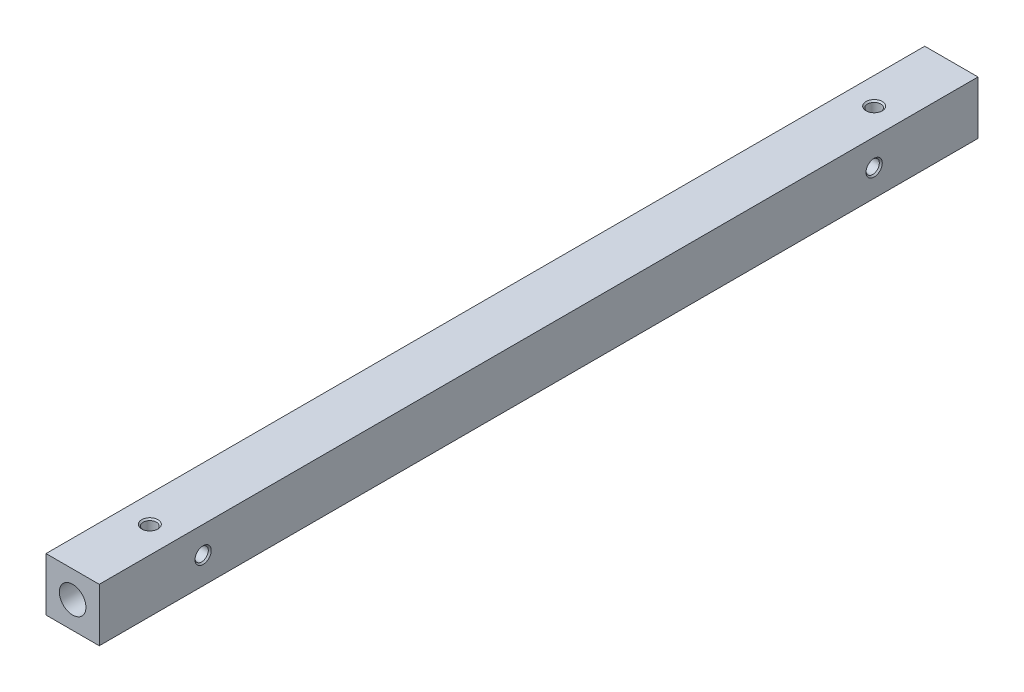
from build123d import *

# Parameters (mm, degrees)
ESQUISSE1_W                     = 10
ESQUISSE1_H                     = 10
BOSS_EXTRU_1_DEPTH              = 82.5
TROU_TARAUD_M3X0_51_D           = 2.5
TROU_TARAUD_M3X0_51_CSINK_D     = 3.05
TROU_TARAUD_M3X0_51_CSINK_ANGLE = 90
TROU_TARAUD_M3X0_52_D           = 2.5
TROU_TARAUD_M3X0_52_CSINK_D     = 3.05
TROU_TARAUD_M3X0_52_CSINK_ANGLE = 90
ESQUISSE6_R                     = 2.5
ENL_V_MAT_EXTRU_1_DEPTH         = 6


with BuildPart() as part:
    # Esquisse1 → Boss.-Extru.1 (new, symmetric)
    with BuildSketch(Plane.XY):
        Rectangle(ESQUISSE1_W, ESQUISSE1_H)
    extrude(amount=BOSS_EXTRU_1_DEPTH, both=True)

    # Trou taraudé M3x0.51 (through all)
    with Locations(Plane(origin=(5, 0, 0), x_dir=(0, 0, -1), z_dir=(1, 0, 0))):
        with Locations((63, 0), (-63, 0)):
            CounterSinkHole(TROU_TARAUD_M3X0_51_D / 2, TROU_TARAUD_M3X0_51_CSINK_D / 2, counter_sink_angle=TROU_TARAUD_M3X0_51_CSINK_ANGLE)

    # Trou taraudé M3x0.52 (through all)
    with Locations(Plane(origin=(0, 5, 0), x_dir=(1, 0, 0), z_dir=(0, 1, 0))):
        with Locations((0, 68), (0, -68)):
            CounterSinkHole(TROU_TARAUD_M3X0_52_D / 2, TROU_TARAUD_M3X0_52_CSINK_D / 2, counter_sink_angle=TROU_TARAUD_M3X0_52_CSINK_ANGLE)

    # Esquisse6 → Enlèv. mat.-Extru.1 (cut)
    with BuildSketch(Plane.XY.offset(82.5)):
        Circle(ESQUISSE6_R)
    extrude(amount=-ENL_V_MAT_EXTRU_1_DEPTH, mode=Mode.SUBTRACT)


solid = part.part
